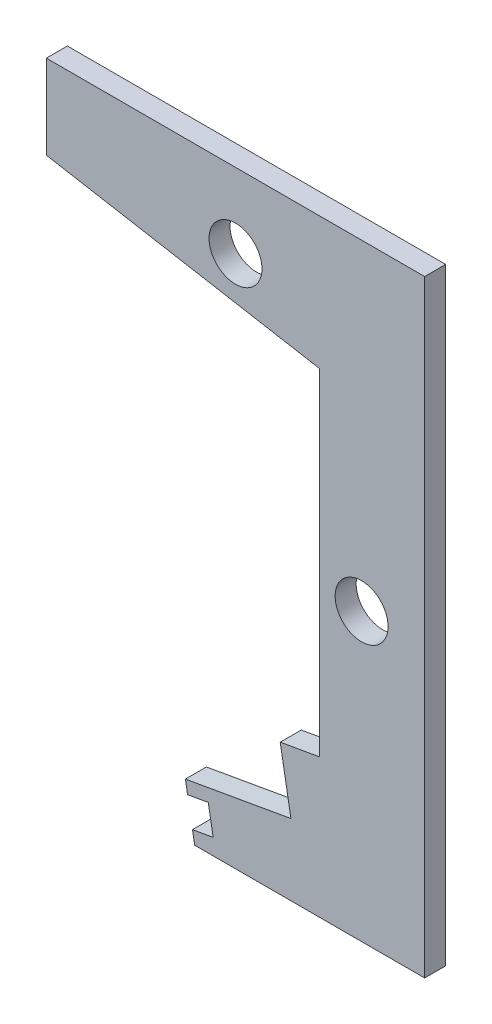
from build123d import *

# Parameters (mm, degrees)
ESQUISSE1_R             = 6.3
BOSS_EXTRU_1_DEPTH      = 5
ENL_V_MAT_EXTRU_1_DEPTH = 5


with BuildPart() as part:
    # Esquisse1 → Boss.-Extru.1 (new body)
    with BuildSketch(Plane.XY):
        Polygon((-65, 51.461253746), (0, 40), (0, -40), (-9.359100785, -41.650261983), (-6.809077296, -56.112163836), (-31.918247866, -60.539588071), (-29.710027076, -73.063030491), (25, -73.063030491), (25, 71.461253746), (-65, 71.461253746), align=None)
        with Locations((-20, 53.680805733)):
            Circle(ESQUISSE1_R, mode=Mode.SUBTRACT)
        with Locations((10, -5)):
            Circle(ESQUISSE1_R, mode=Mode.SUBTRACT)
    extrude(amount=BOSS_EXTRU_1_DEPTH)

    # Esquisse2 → Enlèv. mat.-Extru.1 (cut)
    with BuildSketch(Plane(origin=(0, 0, 0), x_dir=(-1, 0, 0), z_dir=(0, 0, -1))):
        Polygon((31.396602506, -63.497985917), (30.230971609, -70.108607232), (25.306932844, -69.240366344), (26.472563741, -62.629745029), align=None)
    extrude(amount=-ENL_V_MAT_EXTRU_1_DEPTH, mode=Mode.SUBTRACT)


solid = part.part
